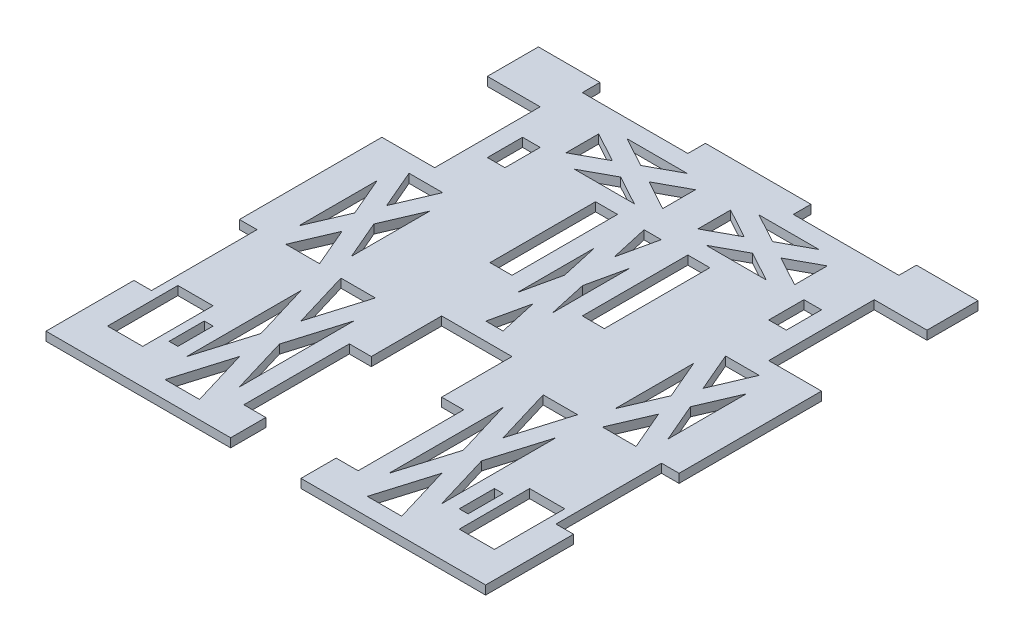
from build123d import *

# Parameters (mm, degrees)
SKETCH1_W           = 317.5
SKETCH1_H           = 355.6
BOSS_EXTRUDE1_DEPTH = 6.35
SKETCH2_W           = 50.8
SKETCH2_H           = 152.4
CUT_EXTRUDE1_DEPTH  = 239.442288615
SKETCH3_W           = 25.4
SKETCH3_H           = 76.2
SKETCH3_W_2         = 12.7
SKETCH3_H_2         = 25.4
CUT_EXTRUDE2_DEPTH  = 239.442288615
SKETCH4_W           = 12.7
SKETCH4_H           = 76.2
SKETCH4_W_2         = 76.2
SKETCH4_H_2         = 12.7
SKETCH4_W_3         = 15.875
CUT_EXTRUDE3_DEPTH  = 239.442288615
SKETCH5_W           = 25.4
SKETCH5_H           = 50.8
SKETCH5_W_2         = 6.35
SKETCH5_H_2         = 25.4
CUT_EXTRUDE4_DEPTH  = 239.442288615


with BuildPart() as part:
    # Sketch1 → Boss-Extrude1 (new body)
    with BuildSketch(Plane(origin=(0, 0, 0), x_dir=(1, 0, 0), z_dir=(0, 1, 0))):
        Rectangle(SKETCH1_W, SKETCH1_H)
    extrude(amount=BOSS_EXTRUDE1_DEPTH)

    # Sketch2 → Cut-Extrude1 (cut, through all)
    with BuildSketch(Plane(origin=(0, 6.35, 0), x_dir=(1, 0, 0), z_dir=(0, 1, 0))):
        with Locations((0, -101.6)):
            Rectangle(SKETCH2_W, SKETCH2_H)
    extrude(amount=-CUT_EXTRUDE1_DEPTH, mode=Mode.SUBTRACT)

    # Sketch3 → Cut-Extrude2 (cut, through all)
    with BuildSketch(Plane(origin=(0, 6.35, 0), x_dir=(1, 0, 0), z_dir=(0, 1, 0))):
        with Locations((133.35, 102.87)):
            Rectangle(SKETCH3_W, SKETCH3_H)
        with Locations((101.6, 102.87)):
            Rectangle(SKETCH3_W_2, SKETCH3_H_2)
        with Locations((-101.6, 102.87)):
            Rectangle(SKETCH3_W_2, SKETCH3_H_2)
        with Locations((-133.35, 102.87)):
            Rectangle(SKETCH3_W, SKETCH3_H)
    extrude(amount=-CUT_EXTRUDE2_DEPTH, mode=Mode.SUBTRACT)

    # Sketch4 → Cut-Extrude3 (cut, through all)
    with BuildSketch(Plane(origin=(0, 6.35, 0), x_dir=(1, 0, 0), z_dir=(0, 1, 0))):
        with Locations((-152.4, 102.87)):
            Rectangle(SKETCH4_W, SKETCH4_H)
        with Locations((-152.4, -76.2)):
            Rectangle(SKETCH4_W, SKETCH4_H)
        with Locations((152.4, 102.87)):
            Rectangle(SKETCH4_W, SKETCH4_H)
        with Locations((152.4, -76.2)):
            Rectangle(SKETCH4_W, SKETCH4_H)
        with Locations((76.2, 171.45)):
            Rectangle(SKETCH4_W_2, SKETCH4_H_2)
        with Locations((-76.2, 171.45)):
            Rectangle(SKETCH4_W_2, SKETCH4_H_2)
        with Locations((-33.3375, -114.3)):
            Rectangle(SKETCH4_W_3, SKETCH4_H)
        with Locations((33.3375, 63.5)):
            Rectangle(SKETCH4_W_3, SKETCH4_H)
        with Locations((-33.3375, 63.5)):
            Rectangle(SKETCH4_W_3, SKETCH4_H)
        with Locations((33.3375, -114.3)):
            Rectangle(SKETCH4_W_3, SKETCH4_H)
    extrude(amount=-CUT_EXTRUDE3_DEPTH, mode=Mode.SUBTRACT)

    # Sketch5 → Cut-Extrude4 (cut, through all)
    with BuildSketch(Plane(origin=(0, 6.35, 0), x_dir=(1, 0, 0), z_dir=(0, 1, 0))):
        Polygon((-73.025, -123.698648777), (-85.445405367, -165.1), (-60.604594633, -165.1), align=None)
        Polygon((-92.075, -60.198648777), (-92.075, -143.001351223), (-79.654594633, -101.6), align=None)
        Polygon((-53.975, -60.198648777), (-66.395405367, -101.6), (-53.975, -143.001351223), align=None)
        Polygon((-85.445405367, -38.1), (-73.025, -79.501351223), (-60.604594633, -38.1), align=None)
        Polygon((-114.3, -8.500053074), (-126.441405825, -36.83), (-102.158594175, -36.83), align=None)
        Polygon((-133.35, 35.949946926), (-133.35, -20.709946926), (-121.208594175, 7.62), align=None)
        Polygon((-95.25, 35.949946926), (-107.391405825, 7.62), (-95.25, -20.709946926), align=None)
        Polygon((-126.441405825, 52.07), (-114.3, 23.740053074), (-102.158594175, 52.07), align=None)
        Polygon((-47.625, 126.116793459), (-69.289121342, 114.3), (-25.960878658, 114.3), align=None)
        Polygon((-82.55, 145.166793459), (-82.55, 121.533206541), (-60.885878658, 133.35), align=None)
        Polygon((-12.7, 145.166793459), (-34.364121342, 133.35), (-12.7, 121.533206541), align=None)
        Polygon((-69.289121342, 152.4), (-47.625, 140.583206541), (-25.960878658, 152.4), align=None)
        Polygon((0, 15.177946348), (-6.195099188, -12.7), (6.195099188, -12.7), align=None)
        Polygon((-12.7, 72.327946348), (-12.7, 16.572053652), (-6.504900812, 44.45), align=None)
        Polygon((12.7, 72.327946348), (6.504900812, 44.45), (12.7, 16.572053652), align=None)
        Polygon((-6.195099188, 101.6), (0, 73.722053652), (6.195099188, 101.6), align=None)
        with Locations((-127, -127)):
            Rectangle(SKETCH5_W, SKETCH5_H)
        with Locations((-104.775, -127)):
            Rectangle(SKETCH5_W_2, SKETCH5_H_2)
    cut_extrude4 = extrude(amount=-CUT_EXTRUDE4_DEPTH, mode=Mode.SUBTRACT)

    # Mirror1: Cut-Extrude4 across plane
    add(cut_extrude4.mirror(Plane(origin=(0, 0, 0), x_dir=(0, 0, 1), z_dir=(1, 0, 0))), mode=Mode.SUBTRACT)


solid = part.part
